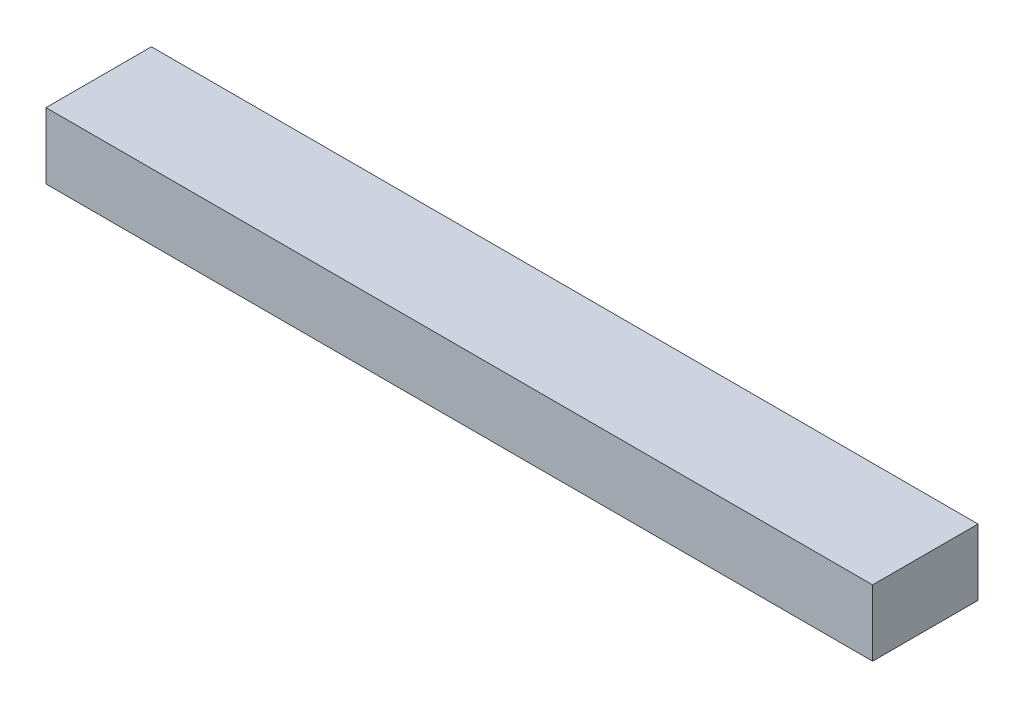
from build123d import *

# Parameters (mm, degrees)
SKETCH1_W           = 12.75
SKETCH1_H           = 8
BOSS_EXTRUDE1_DEPTH = 100


with BuildPart() as part:
    # Sketch1 → Boss-Extrude1 (new body)
    with BuildSketch(Plane(origin=(0, 0, 0), x_dir=(0, 0, -1), z_dir=(1, 0, 0))):
        Rectangle(SKETCH1_W, SKETCH1_H)
    extrude(amount=BOSS_EXTRUDE1_DEPTH)


solid = part.part
